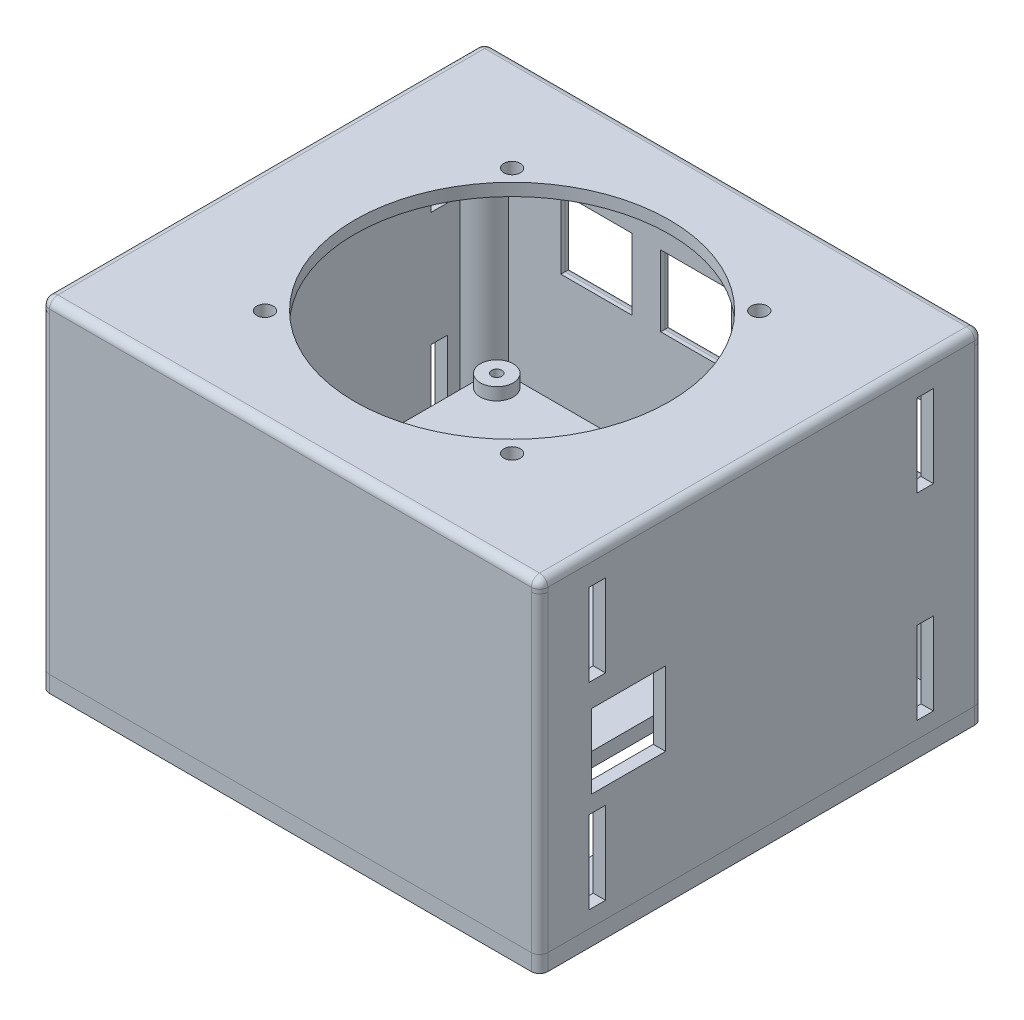
from build123d import *

# Parameters (mm, degrees)
SKETCH1_W            = 115
SKETCH1_H            = 101.6
BOSS_EXTRUDE1_DEPTH  = 75.8
SHELL1_T             = 3
FILLET1_R            = 2
SKETCH15_W           = 120.954654739
SKETCH15_H           = 107.6
BOSS_EXTRUDE2_DEPTH  = 3
SKETCH39_W           = 17.23
SKETCH39_H           = 17.23
CUT_EXTRUDE15_DEPTH  = 10
SKETCH48_R           = 38.205
CUT_EXTRUDE45_DEPTH  = 10
SKETCH52_W           = 121
SKETCH52_H           = 107.6
BOSS_EXTRUDE8_DEPTH  = 4
FILLET6_R            = 2
SKETCH60_W           = 92
SKETCH60_H           = 92
BOSS_EXTRUDE11_DEPTH = 21
SKETCH68_R           = 4
BOSS_EXTRUDE12_DEPTH = 3
SKETCH69_R           = 1.25
CUT_EXTRUDE32_DEPTH  = 10
SKETCH81_R           = 2
CUT_EXTRUDE49_DEPTH  = 3
FILLET12_R           = 2
FILLET13_R           = 2
FILLET7_R            = 3
CUT_EXTRUDE43_DEPTH  = 1.5
SKETCH82_W           = 83
SKETCH82_H           = 61
CUT_EXTRUDE50_DEPTH  = 20
FILLET14_R           = 2
FILLET15_R           = 2
SKETCH77_W           = 18
SKETCH77_H           = 18
CUT_EXTRUDE53_DEPTH  = 3
SKETCH83_W           = 4
SKETCH83_H           = 20
CUT_EXTRUDE55_DEPTH  = 3
CUT_EXTRUDE56_START  = -121
SKETCH83_6_W         = 4
SKETCH83_6_H         = 20
CUT_EXTRUDE56_DEPTH  = 3
BOSS_EXTRUDE18_START = -75.8
BOSS_EXTRUDE18_DEPTH = 75.8
SKETCH91_R           = 1.25
CUT_EXTRUDE57_DEPTH  = 30
SKETCH103_R          = 1.25
CUT_EXTRUDE58_DEPTH  = 10


# Read off the part's stored shape, not the designer's step: Boss-Extrude18
with BuildPart() as part:
    # Sketch1 → Boss-Extrude1 (new body)
    with BuildSketch(Plane(origin=(0, 0, 0), x_dir=(1, 0, 0), z_dir=(0, 1, 0))):
        with Locations((9.466197687, -12.99548022)):
            Rectangle(SKETCH1_W, SKETCH1_H)
    extrude(amount=BOSS_EXTRUDE1_DEPTH)

    # Shell1
    shell1_openings = [part.faces().sort_by_distance(p)[0] for p in [
        (9.466197687, 0, 12.99548022),
        (9.466197687, 75.8, 12.99548022),
    ]]
    offset(amount=SHELL1_T, openings=shell1_openings, kind=Kind.INTERSECTION)

    # Fillet1
    # the kernel refuses this fillet: 2 mm, written as the material it takes off along each edge
    with BuildSketch(Plane(origin=(69.966197687, -5, 66.79548022), x_dir=(-1, 0, 0), z_dir=(0, 1, 0)), Plane(origin=(-51.033802313, 80.8, 66.79548022), x_dir=(1, 0, 0), z_dir=(0, -1, 0)), Plane(origin=(-51.033802313, -5, -40.80451978), x_dir=(1, 0, 0), z_dir=(0, 1, 0)), Plane(origin=(69.966197687, -5, -40.80451978), x_dir=(0, 0, 1), z_dir=(0, 1, 0))) as fillet1_piece_1:
        with BuildLine():
            CenterArc((FILLET1_R, -FILLET1_R), FILLET1_R, 90, 90)
            Line((0, -FILLET1_R), (0, 0))
            Line((0, 0), (FILLET1_R, 0))
        make_face()
    extrude(amount=85.8, mode=Mode.SUBTRACT)

    # Sketch15 → Boss-Extrude2 (add)
    with BuildSketch(Plane(origin=(0, 75.8, 0), x_dir=(1, 0, 0), z_dir=(0, 1, 0))):
        with Locations((9.488870318, -12.99548022)):
            Rectangle(SKETCH15_W, SKETCH15_H)
    extrude(amount=BOSS_EXTRUDE2_DEPTH)

    # Sketch39 → Cut-Extrude15 (cut)
    with BuildSketch(Plane(origin=(0, 0, -40.80451978), x_dir=(-1, 0, 0), z_dir=(0, 0, -1))):
        with Locations((-51.836542948, 50.225)):
            Rectangle(SKETCH39_W, SKETCH39_H)
        with Locations((-27.606542948, 50.225)):
            Rectangle(SKETCH39_W, SKETCH39_H)
        with Locations((-3.376542948, 50.225)):
            Rectangle(SKETCH39_W, SKETCH39_H)
        with Locations((20.853457052, 50.225)):
            Rectangle(SKETCH39_W, SKETCH39_H)
    extrude(amount=-CUT_EXTRUDE15_DEPTH, mode=Mode.SUBTRACT)

    # Sketch48 → Cut-Extrude45 (cut)
    with BuildSketch(Plane(origin=(0, 78.8, 0), x_dir=(1, 0, 0), z_dir=(0, 1, 0))):
        with Locations(Location((9.488870318, -12.99548022, 0), (0, 0, 270))):
            Circle(SKETCH48_R)
    extrude(amount=-CUT_EXTRUDE45_DEPTH, mode=Mode.SUBTRACT)

    # Sketch81 → Cut-Extrude49 (cut)
    with BuildSketch(Plane(origin=(0, 78.8, 0), x_dir=(1, 0, 0), z_dir=(0, 1, 0))):
        with Locations(Location((-20.511129682, -42.99548022, 0), (0, 0, 270))):
            Circle(SKETCH81_R)
        with Locations(Location((39.488870318, -42.99548022, 0), (0, 0, 270))):
            Circle(SKETCH81_R)
        with Locations(Location((-20.511129682, 17.00451978, 0), (0, 0, 270))):
            Circle(SKETCH81_R)
        with Locations(Location((39.488870318, 17.00451978, 0), (0, 0, 270))):
            Circle(SKETCH81_R)
    extrude(amount=-CUT_EXTRUDE49_DEPTH, mode=Mode.SUBTRACT)

    # Fillet12
    fillet12_edges = [part.edges().sort_by_distance(p)[0] for p in [
        (43.221542948, 50.225, -40.80451978),
        (51.836542948, 58.84, -40.80451978),
        (60.451542948, 50.225, -40.80451978),
        (51.836542948, 41.61, -40.80451978),
        (18.991542948, 50.225, -40.80451978),
        (27.606542948, 58.84, -40.80451978),
        (36.221542948, 50.225, -40.80451978),
        (27.606542948, 41.61, -40.80451978),
        (-5.238457052, 50.225, -40.80451978),
        (3.376542948, 58.84, -40.80451978),
        (11.991542948, 50.225, -40.80451978),
        (3.376542948, 41.61, -40.80451978),
        (-29.468457052, 50.225, -40.80451978),
        (-20.853457052, 58.84, -40.80451978),
        (-12.238457052, 50.225, -40.80451978),
        (-20.853457052, 41.61, -40.80451978),
    ]]
    fillet(fillet12_edges, radius=FILLET12_R)

    # Fillet13
    fillet13_edges = [part.edges().sort_by_distance(p)[0] for p in [
        (69.966197687, 78.8, 12.99548022),
    ]]
    fillet(fillet13_edges, radius=FILLET13_R)

    # Fillet14
    # the kernel refuses this fillet: 2 mm, written as the material it takes off along each edge
    with BuildSketch(Plane(origin=(-50.988457052, 70.8, 66.79548022), x_dir=(0, 0, -1), z_dir=(0, 1, 0))) as fillet14_piece_1_section:
        with BuildLine():
            CenterArc((FILLET14_R, -FILLET14_R), FILLET14_R, 90, 90)
            Line((0, -FILLET14_R), (0, 0))
            Line((0, 0), (FILLET14_R, 0))
        make_face()
    fillet14_piece_1 = extrude(amount=13, mode=Mode.PRIVATE)
    fillet14_piece_1 = fillet14_piece_1 - Plane(origin=(-49.033802313, 73.3, 64.79548022), x_dir=(1, 0, 0), z_dir=(0, 1, 0)) * Cylinder(2, 35, mode=Mode.PRIVATE)
    add(fillet14_piece_1, mode=Mode.SUBTRACT)
    with BuildSketch(Plane(origin=(-50.988457052, 75.8, 66.79548022), x_dir=(0, 0, -1), z_dir=(0, 1, 0)), Plane(origin=(-50.988457052, 75.8, -40.80451978), x_dir=(1, 0, 0), z_dir=(0, 1, 0))) as fillet14_piece_2:
        with BuildLine():
            CenterArc((FILLET14_R, -FILLET14_R), FILLET14_R, 90, 90)
            Line((0, -FILLET14_R), (0, 0))
            Line((0, 0), (FILLET14_R, 0))
        make_face()
    extrude(amount=8, mode=Mode.SUBTRACT)
    with BuildSketch(Plane(origin=(-50.988457052, 70.8, -40.80451978), x_dir=(1, 0, 0), z_dir=(0, 1, 0))) as fillet14_piece_3_section:
        with BuildLine():
            CenterArc((FILLET14_R, -FILLET14_R), FILLET14_R, 90, 90)
            Line((0, -FILLET14_R), (0, 0))
            Line((0, 0), (FILLET14_R, 0))
        make_face()
    fillet14_piece_3 = extrude(amount=13, mode=Mode.PRIVATE)
    fillet14_piece_3 = fillet14_piece_3 - Plane(origin=(-49.033802313, 73.3, -38.80451978), x_dir=(1, 0, 0), z_dir=(0, -1, 0)) * Cylinder(2, 35, mode=Mode.PRIVATE)
    add(fillet14_piece_3, mode=Mode.SUBTRACT)

    # Fillet15
    fillet15_edges = [part.edges().sort_by_distance(p)[0] for p in [
        (69.966197687, 76.3, -40.80451978),
        (69.38041125, 78.214213562, -40.80451978),
        (9.488870318, 78.8, -40.80451978),
        (-50.402670614, 78.8, -40.218733342),
        (-50.988457052, 78.8, 12.99548022),
        (-50.402670614, 78.8, 66.209693782),
        (9.488870318, 78.8, 66.79548022),
        (69.38041125, 78.214213562, 66.79548022),
        (69.966197687, 76.3, 66.79548022),
    ]]
    fillet(fillet15_edges, radius=FILLET15_R)

    # Sketch77 → Cut-Extrude53 (cut)
    with BuildSketch(Plane(origin=(69.966197687, 0, 0), x_dir=(0, 0, -1), z_dir=(1, 0, 0))):
        with Locations((-45.19548022, 37)):
            Rectangle(SKETCH77_W, SKETCH77_H)
    extrude(amount=-CUT_EXTRUDE53_DEPTH, mode=Mode.SUBTRACT)

    # Sketch83 → Cut-Extrude55 (cut)
    with BuildSketch(Plane(origin=(69.966197687, 0, 0), x_dir=(0, 0, -1), z_dir=(1, 0, 0))):
        with Locations((-52.79548022, 61.8)):
            Rectangle(SKETCH83_W, SKETCH83_H)
        with Locations((26.80451978, 61.8)):
            Rectangle(SKETCH83_W, SKETCH83_H)
        with Locations((26.80451978, 14)):
            Rectangle(SKETCH83_W, SKETCH83_H)
        with Locations((-52.79548022, 14)):
            Rectangle(SKETCH83_W, SKETCH83_H)
    extrude(amount=-CUT_EXTRUDE55_DEPTH, mode=Mode.SUBTRACT)

    # Sketch83<6> → Cut-Extrude56 (cut)
    with BuildSketch(Plane(origin=(69.966197687, 0, 0), x_dir=(0, 0, -1), z_dir=(1, 0, 0)).offset(CUT_EXTRUDE56_START)):
        with Locations((-52.79548022, 14)):
            Rectangle(SKETCH83_6_W, SKETCH83_6_H)
        with Locations((26.80451978, 14)):
            Rectangle(SKETCH83_6_W, SKETCH83_6_H)
        with Locations((26.80451978, 61.8)):
            Rectangle(SKETCH83_6_W, SKETCH83_6_H)
        with Locations((-52.79548022, 61.8)):
            Rectangle(SKETCH83_6_W, SKETCH83_6_H)
    extrude(amount=CUT_EXTRUDE56_DEPTH, mode=Mode.SUBTRACT)

    # Boss-Extrude18 outline → Boss-Extrude18 (add)
    with BuildSketch(Plane.XZ.offset(BOSS_EXTRUDE18_START)):
        with BuildLine():
            Line((-48.033802313, 63.79548022), (-48.033802313, 57.88548022))
            ThreePointArc((-48.033802313, 57.88548022), (-43.854801236, 59.616479143), (-42.123802313, 63.79548022))
            Line((-42.123802313, 63.79548022), (-48.033802313, 63.79548022))
        make_face()
        with BuildLine():
            ThreePointArc((-42.123802313, -37.80451978), (-43.854801236, -33.625518703), (-48.033802313, -31.89451978))
            Line((-48.033802313, -31.89451978), (-48.033802313, -37.80451978))
            Line((-48.033802313, -37.80451978), (-42.123802313, -37.80451978))
        make_face()
        with BuildLine():
            Line((66.966197687, 63.79548022), (61.056197687, 63.79548022))
            ThreePointArc((61.056197687, 63.79548022), (62.78719661, 59.616479144), (66.966197687, 57.88548022))
            Line((66.966197687, 57.88548022), (66.966197687, 63.79548022))
        make_face()
        with BuildLine():
            ThreePointArc((66.966197687, -31.89451978), (62.78719661, -33.625518703), (61.056197687, -37.80451978))
            Line((61.056197687, -37.80451978), (66.966197687, -37.80451978))
            Line((66.966197687, -37.80451978), (66.966197687, -31.89451978))
        make_face()
    extrude(amount=BOSS_EXTRUDE18_DEPTH)


with BuildPart() as body_2:
    # Sketch52 → Boss-Extrude8 (new body)
    with BuildSketch(Plane.XZ):
        with Locations((9.466197687, 12.99548022)):
            Rectangle(SKETCH52_W, SKETCH52_H)
    extrude(amount=BOSS_EXTRUDE8_DEPTH)

    # Fillet6
    fillet6_edges = [body_2.edges().sort_by_distance(p)[0] for p in [
        (69.966197687, -2, -40.80451978),
        (-51.033802313, -2, -40.80451978),
        (-51.033802313, -2, 66.79548022),
        (69.966197687, -2, 66.79548022),
    ]]
    fillet(fillet6_edges, radius=FILLET6_R)

    # Sketch60 → Boss-Extrude11 (add)
    with BuildSketch(Plane(origin=(0, 0, 0), x_dir=(1, 0, 0), z_dir=(0, 1, 0))):
        with Locations((7.966197687, -15.19548022)):
            Rectangle(SKETCH60_W, SKETCH60_H)
    extrude(amount=BOSS_EXTRUDE11_DEPTH)

    # Sketch68 → Boss-Extrude12 (add)
    with BuildSketch(Plane(origin=(0, 21, 0), x_dir=(1, 0, 0), z_dir=(0, 1, 0))):
        with Locations(Location((-34.033802313, 26.80451978, 0), (0, 0, 90))):
            Circle(SKETCH68_R)
        with Locations(Location((49.966197687, 26.80451978, 0), (0, 0, 90))):
            Circle(SKETCH68_R)
        with Locations(Location((49.966197687, -57.19548022, 0), (0, 0, 270))):
            Circle(SKETCH68_R)
        with Locations(Location((-34.033802313, -57.19548022, 0), (0, 0, 270))):
            Circle(SKETCH68_R)
    extrude(amount=BOSS_EXTRUDE12_DEPTH)

    # Sketch69 → Cut-Extrude32 (cut)
    with BuildSketch(Plane(origin=(0, 24, 0), x_dir=(1, 0, 0), z_dir=(0, 1, 0))):
        with Locations(Location((-34.033802313, 26.80451978, 0), (0, 0, 270))):
            Circle(SKETCH69_R)
        with Locations(Location((-34.033802313, -57.19548022, 0), (0, 0, 270))):
            Circle(SKETCH69_R)
        with Locations(Location((49.966197687, -57.19548022, 0), (0, 0, 270))):
            Circle(SKETCH69_R)
        with Locations(Location((49.966197687, 26.80451978, 0), (0, 0, 270))):
            Circle(SKETCH69_R)
    extrude(amount=-CUT_EXTRUDE32_DEPTH, mode=Mode.SUBTRACT)

    # Fillet7
    fillet7_edges = [body_2.edges().sort_by_distance(p)[0] for p in [
        (-38.033802313, 10.5, -30.80451978),
        (-38.033802313, 10.5, 61.19548022),
        (53.966197687, 10.5, 61.19548022),
        (53.966197687, 10.5, -30.80451978),
    ]]
    fillet(fillet7_edges, radius=FILLET7_R)

    # Sketch78 → Cut-Extrude43 (cut)
    with BuildSketch(Plane.XZ.offset(4)):
        Polygon((2.466197687, 52.19548022), (-38.033802313, 52.19548022), (-38.033802313, -25.80451978), (54.966197687, -25.80451978), (54.966197687, 52.19548022), align=None)
    extrude(amount=-CUT_EXTRUDE43_DEPTH, mode=Mode.SUBTRACT)

    # Sketch82 → Cut-Extrude50 (cut)
    with BuildSketch(Plane.XZ.offset(2.5)):
        with Locations((13.466197687, 13.19548022)):
            Rectangle(SKETCH82_W, SKETCH82_H)
    extrude(amount=-CUT_EXTRUDE50_DEPTH, mode=Mode.SUBTRACT)


with BuildPart() as cut_extrude57_tool:
    # Sketch91 → Cut-Extrude57 (new body)
    with BuildSketch(Plane.XZ.offset(4)):
        with Locations(Location((66.966197687, -37.80451978, 0), (0, 0, 270))):
            Circle(SKETCH91_R)
        with Locations(Location((-48.033802313, -37.80451978, 0), (0, 0, 270))):
            Circle(SKETCH91_R)
        with Locations(Location((66.966197687, 63.79548022, 0), (0, 0, 270))):
            Circle(SKETCH91_R)
        with Locations(Location((-48.033802313, 63.79548022, 0), (0, 0, 270))):
            Circle(SKETCH91_R)
    extrude(amount=-CUT_EXTRUDE57_DEPTH)


with BuildPart() as part_1:
    add(part.part)

    # Cut-Extrude57: cut by cut_extrude57_tool
    add(cut_extrude57_tool.part, mode=Mode.SUBTRACT)


with BuildPart() as body_2_1:
    add(body_2.part)

    # Cut-Extrude57: cut by cut_extrude57_tool
    add(cut_extrude57_tool.part, mode=Mode.SUBTRACT)

    # Sketch103 → Cut-Extrude58 (cut)
    with BuildSketch(Plane.XZ.offset(2.5)):
        with Locations(Location((-33.033802313, 47.19548022, 0), (0, 0, 270))):
            Circle(SKETCH103_R)
        with Locations(Location((-33.033802313, -20.80451978, 0), (0, 0, 90))):
            Circle(SKETCH103_R)
        with Locations(Location((49.966197687, -20.80451978, 0), (0, 0, 270))):
            Circle(SKETCH103_R)
        with Locations(Location((49.966197687, 47.19548022, 0), (0, 0, 90))):
            Circle(SKETCH103_R)
    extrude(amount=-CUT_EXTRUDE58_DEPTH, mode=Mode.SUBTRACT)


solid = Compound([part_1.part, body_2_1.part])
